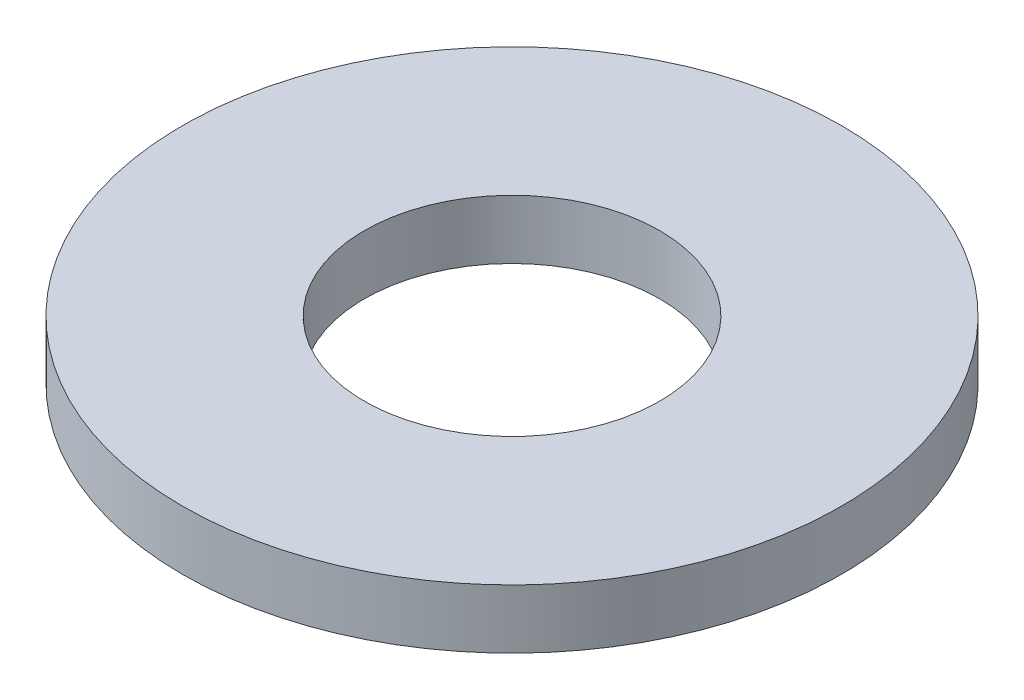
from build123d import *

# Parameters (mm, degrees)
SKETCH1_R           = 72.5
BOSS_EXTRUDE1_DEPTH = 13
SKETCH2_R           = 32.5
CUT_EXTRUDE1_DEPTH  = 104.351342517


with BuildPart() as part:
    # Sketch1 → Boss-Extrude1 (new body)
    with BuildSketch(Plane(origin=(0, 0, 0), x_dir=(1, 0, 0), z_dir=(0, 1, 0))):
        Circle(SKETCH1_R)
    extrude(amount=BOSS_EXTRUDE1_DEPTH)

    # Sketch2 → Cut-Extrude1 (cut, through all)
    with BuildSketch(Plane(origin=(0, 0, 0), x_dir=(1, 0, 0), z_dir=(0, 1, 0))):
        Circle(SKETCH2_R)
    extrude(amount=CUT_EXTRUDE1_DEPTH, mode=Mode.SUBTRACT)


solid = part.part
